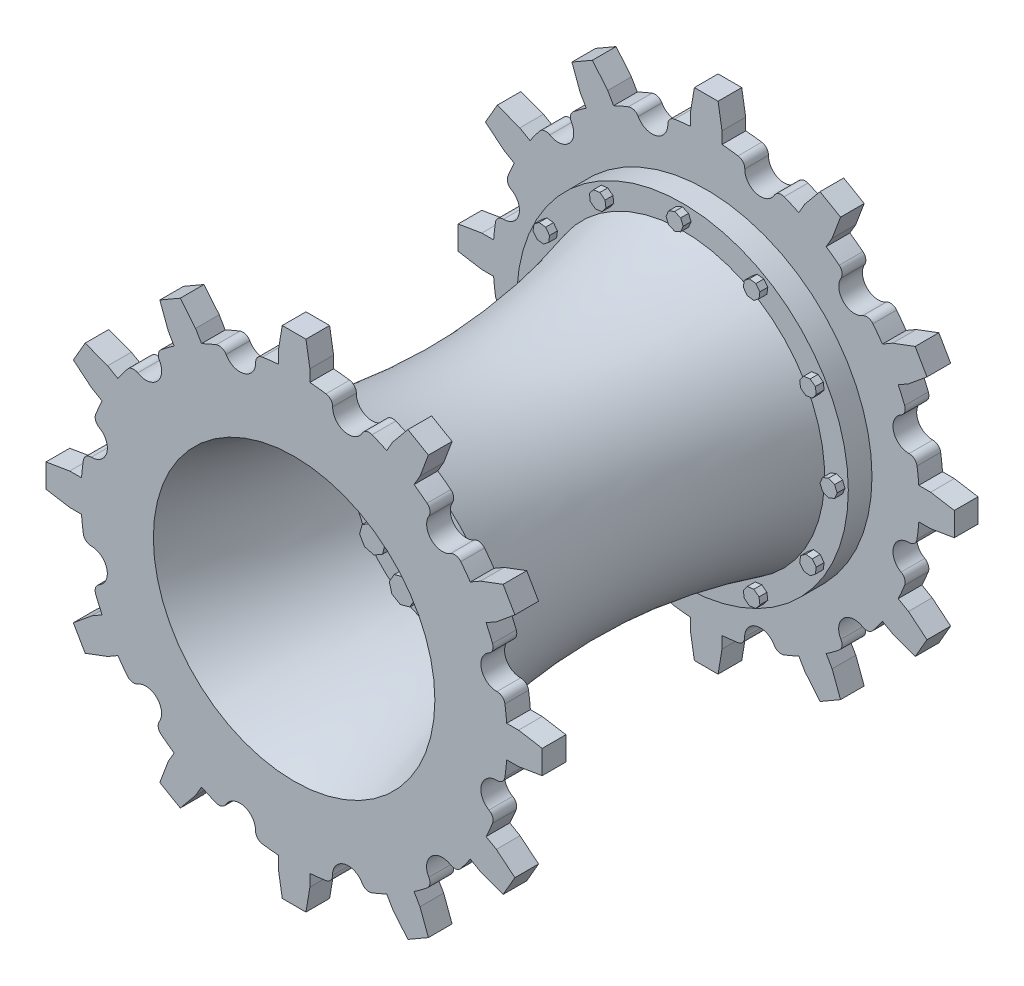
from build123d import *
from build123d.topology import SkipClean

# Parameters (mm, degrees)
Y_KSEKLIK_EKSTR_ZYON2_DEPTH  = 30
IZIM2_R                      = 210
Y_KSEKLIK_EKSTR_ZYON3_DEPTH  = 30
Y_KSEKLIK_EKSTR_ZYON4_DEPTH  = 10
IZIM15_R                     = 45
KES_EKSTR_ZYON2_DEPTH        = 768
IZIM19_R                     = 130.354495242
Y_KSEKLIK_EKSTR_ZYON8_DEPTH  = 96
IZIM20_R                     = 75
Y_KSEKLIK_EKSTR_ZYON12_DEPTH = 16
IZIM23_R                     = 75
Y_KSEKLIK_EKSTR_ZYON13_DEPTH = 15
RADYUS3_R                    = 40


with BuildPart() as part:
    # Çizim1 → Yükseklik-Ekstrüzyon2 (new body)
    with BuildSketch(Plane.XY):
        with BuildLine():
            Line((-20, 269.258240357), (-20, 284.258240357))
            Line((-20, 284.258240357), (-15, 314.258240357))
            Line((-15, 314.258240357), (15, 314.258240357))
            Line((15, 314.258240357), (20, 284.258240357))
            Line((20, 284.258240357), (20, 269.258240357))
            ThreePointArc((20, 269.258240357), (30.191001847, 268.306733809), (40.338617327, 266.969653617))
            ThreePointArc((40.338617327, 266.969653617), (46.483816709, 263.534971921), (48.842978296, 256.902109008))
            ThreePointArc((48.842978296, 256.902109008), (63.65638395, 237.225905098), (86.330228348, 246.842909185))
            ThreePointArc((86.330228348, 246.842909185), (91.693051472, 251.403681264), (98.73221837, 251.300515431))
            ThreePointArc((98.73221837, 251.300515431), (108.096612484, 247.416899927), (117.308612103, 243.184476327))
            Line((117.308612103, 243.184476327), (124.808612103, 256.174857384))
            Line((124.808612103, 256.174857384), (144.138739122, 279.655619498))
            Line((144.138739122, 279.655619498), (170.119501235, 264.655619498))
            Line((170.119501235, 264.655619498), (159.449628254, 236.174857384))
            Line((159.449628254, 236.174857384), (151.949628254, 223.184476327))
            ThreePointArc((151.949628254, 223.184476327), (160.29954147, 217.264946562), (168.419094167, 211.033193408))
            ThreePointArc((168.419094167, 211.033193408), (172.023652096, 204.986072114), (170.750314505, 198.062263539))
            ThreePointArc((170.750314505, 198.062263539), (173.740998163, 173.615468276), (198.185625457, 170.607115924))
            ThreePointArc((198.185625457, 170.607115924), (205.110352557, 171.875448843), (211.154866996, 168.266521162))
            ThreePointArc((211.154866996, 168.266521162), (217.322862438, 160.221014421), (223.184476327, 151.949628254))
            Line((223.184476327, 151.949628254), (236.174857384, 159.449628254))
            Line((236.174857384, 159.449628254), (264.655619498, 170.119501235))
            Line((264.655619498, 170.119501235), (279.655619498, 144.138739122))
            Line((279.655619498, 144.138739122), (256.174857384, 124.808612103))
            Line((256.174857384, 124.808612103), (243.184476327, 117.308612103))
            ThreePointArc((243.184476327, 117.308612103), (247.455948409, 108.007192339), (251.371810735, 98.55055945))
            ThreePointArc((251.371810735, 98.55055945), (251.469888824, 91.511319825), (246.905241835, 86.151794503))
            ThreePointArc((246.905241835, 86.151794503), (237.271852226, 63.484906935), (256.937344273, 48.657283729))
            ThreePointArc((256.937344273, 48.657283729), (263.568500315, 46.293328707), (266.998739532, 40.145648435))
            ThreePointArc((266.998739532, 40.145648435), (268.317626904, 30.09403749), (269.258240357, 20))
            Line((269.258240357, 20), (284.258240357, 20))
            Line((284.258240357, 20), (314.258240357, 15))
            Line((314.258240357, 15), (314.258240357, -15))
            Line((314.258240357, -15), (284.258240357, -20))
            Line((284.258240357, -20), (269.258240357, -20))
            ThreePointArc((269.258240357, -20), (268.306733809, -30.191001847), (266.969653617, -40.338617327))
            ThreePointArc((266.969653617, -40.338617327), (263.534971921, -46.483816709), (256.902109008, -48.842978296))
            ThreePointArc((256.902109008, -48.842978296), (237.225905098, -63.65638395), (246.842909185, -86.330228348))
            ThreePointArc((246.842909185, -86.330228348), (251.403681264, -91.693051472), (251.300515431, -98.73221837))
            ThreePointArc((251.300515431, -98.73221837), (247.416899927, -108.096612484), (243.184476327, -117.308612103))
            Line((243.184476327, -117.308612103), (256.174857384, -124.808612103))
            Line((256.174857384, -124.808612103), (279.655619498, -144.138739122))
            Line((279.655619498, -144.138739122), (264.655619498, -170.119501235))
            Line((264.655619498, -170.119501235), (236.174857384, -159.449628254))
            Line((236.174857384, -159.449628254), (223.184476327, -151.949628254))
            ThreePointArc((223.184476327, -151.949628254), (217.264946562, -160.29954147), (211.033193408, -168.419094167))
            ThreePointArc((211.033193408, -168.419094167), (204.986072114, -172.023652096), (198.062263539, -170.750314505))
            ThreePointArc((198.062263539, -170.750314505), (173.615468276, -173.740998163), (170.607115924, -198.185625457))
            ThreePointArc((170.607115924, -198.185625457), (171.875448843, -205.110352557), (168.266521162, -211.154866996))
            ThreePointArc((168.266521162, -211.154866996), (160.221014421, -217.322862438), (151.949628254, -223.184476327))
            Line((151.949628254, -223.184476327), (159.449628254, -236.174857384))
            Line((159.449628254, -236.174857384), (170.119501235, -264.655619498))
            Line((170.119501235, -264.655619498), (144.138739122, -279.655619498))
            Line((144.138739122, -279.655619498), (124.808612103, -256.174857384))
            Line((124.808612103, -256.174857384), (117.308612103, -243.184476327))
            ThreePointArc((117.308612103, -243.184476327), (108.007192339, -247.455948409), (98.55055945, -251.371810735))
            ThreePointArc((98.55055945, -251.371810735), (91.511319825, -251.469888824), (86.151794503, -246.905241835))
            ThreePointArc((86.151794503, -246.905241835), (63.484906935, -237.271852226), (48.657283729, -256.937344273))
            ThreePointArc((48.657283729, -256.937344273), (46.293328707, -263.568500315), (40.145648435, -266.998739532))
            ThreePointArc((40.145648435, -266.998739532), (30.09403749, -268.317626904), (20, -269.258240357))
            Line((20, -269.258240357), (20, -284.258240357))
            Line((20, -284.258240357), (15, -314.258240357))
            Line((15, -314.258240357), (-15, -314.258240357))
            Line((-15, -314.258240357), (-20, -284.258240357))
            Line((-20, -284.258240357), (-20, -269.258240357))
            ThreePointArc((-20, -269.258240357), (-30.191001847, -268.306733809), (-40.338617327, -266.969653617))
            ThreePointArc((-40.338617327, -266.969653617), (-46.483816709, -263.534971921), (-48.842978296, -256.902109008))
            ThreePointArc((-48.842978296, -256.902109008), (-63.65638395, -237.225905098), (-86.330228348, -246.842909185))
            ThreePointArc((-86.330228348, -246.842909185), (-91.693051472, -251.403681264), (-98.73221837, -251.300515431))
            ThreePointArc((-98.73221837, -251.300515431), (-108.096612484, -247.416899927), (-117.308612103, -243.184476327))
            Line((-117.308612103, -243.184476327), (-124.808612103, -256.174857384))
            Line((-124.808612103, -256.174857384), (-144.138739122, -279.655619498))
            Line((-144.138739122, -279.655619498), (-170.119501235, -264.655619498))
            Line((-170.119501235, -264.655619498), (-159.449628254, -236.174857384))
            Line((-159.449628254, -236.174857384), (-151.949628254, -223.184476327))
            ThreePointArc((-151.949628254, -223.184476327), (-160.29954147, -217.264946562), (-168.419094167, -211.033193408))
            ThreePointArc((-168.419094167, -211.033193408), (-172.023652096, -204.986072114), (-170.750314505, -198.062263539))
            ThreePointArc((-170.750314505, -198.062263539), (-173.740998163, -173.615468276), (-198.185625457, -170.607115924))
            ThreePointArc((-198.185625457, -170.607115924), (-205.110352557, -171.875448843), (-211.154866996, -168.266521162))
            ThreePointArc((-211.154866996, -168.266521162), (-217.322862438, -160.221014421), (-223.184476327, -151.949628254))
            Line((-223.184476327, -151.949628254), (-236.174857384, -159.449628254))
            Line((-236.174857384, -159.449628254), (-264.655619498, -170.119501235))
            Line((-264.655619498, -170.119501235), (-279.655619498, -144.138739122))
            Line((-279.655619498, -144.138739122), (-256.174857384, -124.808612103))
            Line((-256.174857384, -124.808612103), (-243.184476327, -117.308612103))
            ThreePointArc((-243.184476327, -117.308612103), (-247.455948409, -108.007192339), (-251.371810735, -98.55055945))
            ThreePointArc((-251.371810735, -98.55055945), (-251.469888824, -91.511319825), (-246.905241835, -86.151794503))
            ThreePointArc((-246.905241835, -86.151794503), (-237.271852226, -63.484906935), (-256.937344273, -48.657283729))
            ThreePointArc((-256.937344273, -48.657283729), (-263.568500315, -46.293328707), (-266.998739532, -40.145648435))
            ThreePointArc((-266.998739532, -40.145648435), (-268.317626904, -30.09403749), (-269.258240357, -20))
            Line((-269.258240357, -20), (-284.258240357, -20))
            Line((-284.258240357, -20), (-314.258240357, -15))
            Line((-314.258240357, -15), (-314.258240357, 15))
            Line((-314.258240357, 15), (-284.258240357, 20))
            Line((-284.258240357, 20), (-269.258240357, 20))
            ThreePointArc((-269.258240357, 20), (-268.306733809, 30.191001847), (-266.969653617, 40.338617327))
            ThreePointArc((-266.969653617, 40.338617327), (-263.534971921, 46.483816709), (-256.902109008, 48.842978296))
            ThreePointArc((-256.902109008, 48.842978296), (-237.225905098, 63.65638395), (-246.842909185, 86.330228348))
            ThreePointArc((-246.842909185, 86.330228348), (-251.403681264, 91.693051472), (-251.300515431, 98.73221837))
            ThreePointArc((-251.300515431, 98.73221837), (-247.416899927, 108.096612484), (-243.184476327, 117.308612103))
            Line((-243.184476327, 117.308612103), (-256.174857384, 124.808612103))
            Line((-256.174857384, 124.808612103), (-279.655619498, 144.138739122))
            Line((-279.655619498, 144.138739122), (-264.655619498, 170.119501235))
            Line((-264.655619498, 170.119501235), (-236.174857384, 159.449628254))
            Line((-236.174857384, 159.449628254), (-223.184476327, 151.949628254))
            ThreePointArc((-223.184476327, 151.949628254), (-217.264946562, 160.29954147), (-211.033193408, 168.419094167))
            ThreePointArc((-211.033193408, 168.419094167), (-204.986072114, 172.023652096), (-198.062263539, 170.750314505))
            ThreePointArc((-198.062263539, 170.750314505), (-173.615468276, 173.740998163), (-170.607115924, 198.185625457))
            ThreePointArc((-170.607115924, 198.185625457), (-171.875448843, 205.110352557), (-168.266521162, 211.154866996))
            ThreePointArc((-168.266521162, 211.154866996), (-160.221014421, 217.322862438), (-151.949628254, 223.184476327))
            Line((-151.949628254, 223.184476327), (-159.449628254, 236.174857384))
            Line((-159.449628254, 236.174857384), (-170.119501235, 264.655619498))
            Line((-170.119501235, 264.655619498), (-144.138739122, 279.655619498))
            Line((-144.138739122, 279.655619498), (-124.808612103, 256.174857384))
            Line((-124.808612103, 256.174857384), (-117.308612103, 243.184476327))
            ThreePointArc((-117.308612103, 243.184476327), (-108.007192339, 247.455948409), (-98.55055945, 251.371810735))
            ThreePointArc((-98.55055945, 251.371810735), (-91.511319825, 251.469888824), (-86.151794503, 246.905241835))
            ThreePointArc((-86.151794503, 246.905241835), (-63.484906935, 237.271852226), (-48.657283729, 256.937344273))
            ThreePointArc((-48.657283729, 256.937344273), (-46.293328707, 263.568500315), (-40.145648435, 266.998739532))
            ThreePointArc((-40.145648435, 266.998739532), (-30.09403749, 268.317626904), (-20, 269.258240357))
        make_face()
    extrude(amount=Y_KSEKLIK_EKSTR_ZYON2_DEPTH)

    # Çizim2 → Yükseklik-Ekstrüzyon3 (add)
    with BuildSketch(Plane.XY.offset(30)):
        Circle(IZIM2_R)
    extrude(amount=Y_KSEKLIK_EKSTR_ZYON3_DEPTH)

    # Çizim3 → Yükseklik-Ekstrüzyon4 (add)
    with BuildSketch(Plane.XY.offset(60)):
        Polygon((-159.501162315, 92.088038999), (-158.419847934, 100.301437157), (-163.462992737, 106.873791423), (-171.676390895, 107.955105804), (-178.248745161, 102.911961001), (-179.330059542, 94.698562843), (-174.286914739, 88.126208577), (-166.073516581, 87.044894196), align=None)
        Polygon((-184.176077997, 0), (-187.346331353, 7.653668647), (-195, 10.823922003), (-202.653668647, 7.653668647), (-205.823922003, 0), (-202.653668647, -7.653668647), (-195, -10.823922003), (-187.346331353, -7.653668647), align=None)
        Polygon((-92.088038999, 159.501162315), (-87.044894196, 166.073516581), (-88.126208577, 174.286914739), (-94.698562843, 179.330059542), (-102.911961001, 178.248745161), (-107.955105804, 171.676390895), (-106.873791423, 163.462992737), (-100.301437157, 158.419847934), align=None)
        Polygon((0, 184.176077997), (7.653668647, 187.346331353), (10.823922003, 195), (7.653668647, 202.653668647), (0, 205.823922003), (-7.653668647, 202.653668647), (-10.823922003, 195), (-7.653668647, 187.346331353), align=None)
        Polygon((92.088038999, 159.501162315), (100.301437157, 158.419847934), (106.873791423, 163.462992737), (107.955105804, 171.676390895), (102.911961001, 178.248745161), (94.698562843, 179.330059542), (88.126208577, 174.286914739), (87.044894196, 166.073516581), align=None)
        Polygon((159.501162315, 92.088038999), (166.073516581, 87.044894196), (174.286914739, 88.126208577), (179.330059542, 94.698562843), (178.248745161, 102.911961001), (171.676390895, 107.955105804), (163.462992737, 106.873791423), (158.419847934, 100.301437157), align=None)
        Polygon((184.176077997, 0), (187.346331353, -7.653668647), (195, -10.823922003), (202.653668647, -7.653668647), (205.823922003, 0), (202.653668647, 7.653668647), (195, 10.823922003), (187.346331353, 7.653668647), align=None)
        Polygon((159.501162315, -92.088038999), (158.419847934, -100.301437157), (163.462992737, -106.873791423), (171.676390895, -107.955105804), (178.248745161, -102.911961001), (179.330059542, -94.698562843), (174.286914739, -88.126208577), (166.073516581, -87.044894196), align=None)
        Polygon((92.088038999, -159.501162315), (87.044894196, -166.073516581), (88.126208577, -174.286914739), (94.698562843, -179.330059542), (102.911961001, -178.248745161), (107.955105804, -171.676390895), (106.873791423, -163.462992736), (100.301437157, -158.419847934), align=None)
        Polygon((0, -184.176077997), (-7.653668647, -187.346331353), (-10.823922003, -195), (-7.653668647, -202.653668647), (0, -205.823922003), (7.653668647, -202.653668647), (10.823922003, -195), (7.653668647, -187.346331353), align=None)
        Polygon((-92.088038999, -159.501162315), (-100.301437157, -158.419847934), (-106.873791423, -163.462992737), (-107.955105804, -171.676390895), (-102.911961001, -178.248745161), (-94.698562843, -179.330059542), (-88.126208577, -174.286914739), (-87.044894196, -166.073516581), align=None)
        Polygon((-159.501162315, -92.088038999), (-166.073516581, -87.044894196), (-174.286914739, -88.126208577), (-179.330059542, -94.698562843), (-178.248745161, -102.911961001), (-171.676390895, -107.955105804), (-163.462992737, -106.873791423), (-158.419847934, -100.301437157), align=None)
    extrude(amount=Y_KSEKLIK_EKSTR_ZYON4_DEPTH)

    # Çizim15 → Kes-Ekstrüzyon2 (cut)
    with BuildSketch(Plane(origin=(0, 0, 0), x_dir=(-1, 0, 0), z_dir=(0, 0, -1))):
        Circle(IZIM15_R)
    extrude(amount=-KES_EKSTR_ZYON2_DEPTH, mode=Mode.SUBTRACT)

    # Çizim17 → Döndür2 (revolve)
    with BuildSketch(Plane(origin=(0, 0, 0), x_dir=(0, 0, -1), z_dir=(1, 0, 0)), mode=Mode.PRIVATE) as d_nd_r2_sk:
        with BuildLine():
            Line((-60, 45), (-276, 45))
            Line((-276, 45), (-276, 150))
            ThreePointArc((-276, 150), (-166.963308928, 157.535824279), (-60, 180))
            Line((-60, 180), (-60, 45))
        make_face()
    revolve(d_nd_r2_sk.sketch.rotate(Axis((0, 0, 0), (0, 0, 1)), 90), axis=Axis((0, 0, 0), (0, 0, 1)))

    # Aynalama5: part across plane


with BuildPart() as part_1:
    add(part.part)
    add(part.part.mirror(Plane(origin=(0, 45, 276), x_dir=(1, 0, 0), z_dir=(0, 0, 1))))

    # Çizim18 → Kes-Döndür2 (revolve, cut)
    with SkipClean():  # the faces are left unmerged after this step: merging them gives an invalid solid
        with BuildSketch(Plane(origin=(0, 0, 0), x_dir=(0, 0, -1), z_dir=(1, 0, 0)), mode=Mode.PRIVATE) as kes_d_nd_r2_sk:
            with BuildLine():
                Line((-252, 0), (-642.200009474, 0))
                Line((-642.200009474, 0), (-642.200009474, 217.192312516))
                ThreePointArc((-642.200009474, 217.192312516), (-452.523123834, 149.404975588), (-252, 130.354495242))
                Line((-252, 130.354495242), (-252, 0))
            make_face()
        revolve(kes_d_nd_r2_sk.sketch.rotate(Axis((0, 0, 252), (0, 0, 1)), 90), axis=Axis((0, 0, 252), (0, 0, 1)), mode=Mode.SUBTRACT)

    # Çizim19 → Yükseklik-Ekstrüzyon8 (add)
    with SkipClean():  # the faces are left unmerged after this step: merging them gives an invalid solid
        with BuildSketch(Plane.XY.offset(252)):
            with Locations(Location((0, 0, 0), (0, 0, 180))):
                Circle(IZIM19_R)
        extrude(amount=Y_KSEKLIK_EKSTR_ZYON8_DEPTH)

    # Çizim20 → Yükseklik-Ekstrüzyon12 (add)
    with SkipClean():  # the faces are left unmerged after this step: merging them gives an invalid solid
        with BuildSketch(Plane.XY.offset(348)):
            Circle(IZIM20_R)
            Polygon((67.435606585, 86.801896844), (64.219415825, 98.804884169), (53.457831796, 105.018087605), (41.454844471, 101.801896844), (35.241641036, 91.040312816), (38.457831796, 79.037325491), (49.219415825, 72.824122056), (61.222403149, 76.040312816), align=None)
            Polygon((15, 108.890451056), (6.213203436, 117.677247621), (-6.213203436, 117.677247621), (-15, 108.890451056), (-15, 96.464044185), (-6.213203436, 87.677247621), (6.213203436, 87.677247621), (15, 96.464044185), align=None)
            Polygon((101.801896844, 41.454844471), (105.018087605, 53.457831796), (98.804884169, 64.219415825), (86.801896844, 67.435606585), (76.040312816, 61.222403149), (72.824122056, 49.219415825), (79.037325491, 38.457831796), (91.040312816, 35.241641036), align=None)
            Polygon((108.890451056, -15), (117.677247621, -6.213203436), (117.677247621, 6.213203436), (108.890451056, 15), (96.464044185, 15), (87.677247621, 6.213203436), (87.677247621, -6.213203436), (96.464044185, -15), align=None)
            Polygon((86.801896844, -67.435606585), (98.804884169, -64.219415825), (105.018087605, -53.457831796), (101.801896844, -41.454844471), (91.040312816, -35.241641036), (79.037325491, -38.457831796), (72.824122056, -49.219415825), (76.040312816, -61.222403149), align=None)
            Polygon((41.454844471, -101.801896844), (53.457831796, -105.018087605), (64.219415825, -98.804884169), (67.435606585, -86.801896844), (61.222403149, -76.040312816), (49.219415825, -72.824122056), (38.457831796, -79.037325491), (35.241641036, -91.040312816), align=None)
            Polygon((-15, -108.890451056), (-6.213203436, -117.677247621), (6.213203436, -117.677247621), (15, -108.890451056), (15, -96.464044185), (6.213203436, -87.677247621), (-6.213203436, -87.677247621), (-15, -96.464044185), align=None)
            Polygon((-67.435606585, -86.801896844), (-64.219415825, -98.804884169), (-53.457831796, -105.018087605), (-41.454844471, -101.801896844), (-35.241641036, -91.040312816), (-38.457831796, -79.037325491), (-49.219415825, -72.824122056), (-61.222403149, -76.040312816), align=None)
            Polygon((-101.801896844, -41.454844471), (-105.018087605, -53.457831796), (-98.804884169, -64.219415825), (-86.801896844, -67.435606585), (-76.040312816, -61.222403149), (-72.824122056, -49.219415825), (-79.037325491, -38.457831796), (-91.040312816, -35.241641036), align=None)
            Polygon((-108.890451056, 15), (-117.677247621, 6.213203436), (-117.677247621, -6.213203436), (-108.890451056, -15), (-96.464044185, -15), (-87.677247621, -6.213203436), (-87.677247621, 6.213203436), (-96.464044185, 15), align=None)
            Polygon((-86.801896844, 67.435606585), (-98.804884169, 64.219415825), (-105.018087605, 53.457831796), (-101.801896844, 41.454844471), (-91.040312816, 35.241641036), (-79.037325491, 38.457831796), (-72.824122056, 49.219415825), (-76.040312816, 61.222403149), align=None)
            Polygon((-41.454844471, 101.801896844), (-53.457831796, 105.018087605), (-64.219415825, 98.804884169), (-67.435606585, 86.801896844), (-61.222403149, 76.040312816), (-49.219415825, 72.824122056), (-38.457831796, 79.037325491), (-35.241641036, 91.040312816), align=None)
        extrude(amount=Y_KSEKLIK_EKSTR_ZYON12_DEPTH)

    # Çizim23 → Yükseklik-Ekstrüzyon13 (add)
    with SkipClean():  # the faces are left unmerged after this step: merging them gives an invalid solid
        with BuildSketch(Plane.XY.offset(364)):
            Circle(IZIM23_R)
        extrude(amount=Y_KSEKLIK_EKSTR_ZYON13_DEPTH)

    # Radyus3
    # the kernel refuses this fillet: 40 mm, written as the material it takes off along each edge
    with BuildSketch(Plane(origin=(0, 0, 379), x_dir=(1, 0, 0), z_dir=(0, -1, 0))) as radyus3_piece_1:
        with BuildLine():
            CenterArc((36.02564946, -40), RADYUS3_R, 13.002878163, 76.997121837)
            Line((36.02564946, 0), (36.02564946, 0.8))
            Line((36.02564946, 0.8), (75, 0.8))
            Line((75, 0.8), (75.8, 0))
            ThreePointArc((75.8, 0), (75.8, -15.5), (75.779487011, -30.82))
            Line((75.779487011, -30.82), (75, -31))
        make_face()
    revolve(axis=Axis((0, 0, 379), (0, 0, 1)), mode=Mode.SUBTRACT)


solid = part_1.part
